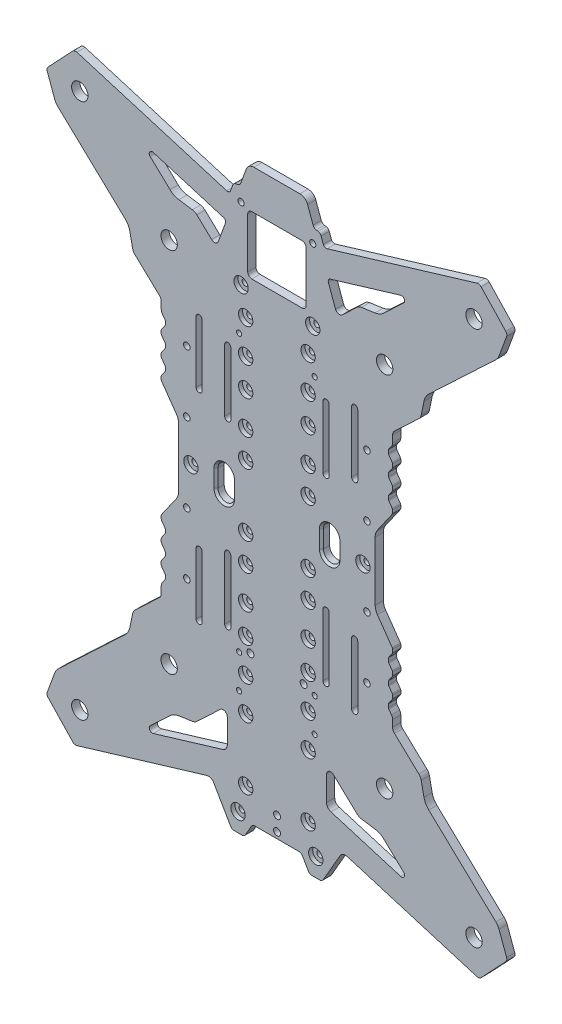
from build123d import *

# Parameters (mm, degrees)
MODEL_R                               = 1.5
MODEL_R_2                             = 4
MAIN_BODY_DEPTH                       = 4
LOWER_START                           = -2
SKETCH2_R                             = 3.5
SKETCH2_R_2                           = 1.5
LOWER_FIXTURE_POINT_COUNTERSINK_DEPTH = 2
EXTRA_BATTERY_STRAP_FIXTURES_REACH    = 419.565
BATTERY_CABLE_INGRESS_REACH           = 419.565
BATTERY_CABLE_INGRESS_CHAMFER_SIZE    = 1
MAUCH_PL200_MOUNTING_POINTS_REACH     = 419.565
SKETCH5_R                             = 1.25
RFD_CARRIER_MOUNTING_POINTS_REACH     = 419.565
SKETCH6_R                             = 1.7
ESC_CARRIER_FIXTURES_POINTS_REACH     = 419.565
SKETCH7_R                             = 1.6


with BuildPart() as part:
    # Model → Main Body (new body)
    with BuildSketch(Plane.XY):
        with BuildLine():
            Line((261.034392191, 314.782999023), (273.061648382, 302.032656534))
            ThreePointArc((273.061648382, 302.032656534), (273.565856978, 301.062828157), (273.484893514, 299.972764714))
            Line((273.484893514, 299.972764714), (269.784614814, 289.86483769))
            ThreePointArc((269.784614814, 289.86483769), (269.160003791, 288.625512695), (268.26736368, 287.562846704))
            Line((268.26736368, 287.562846704), (235.488392783, 256.642773314))
            ThreePointArc((235.488392783, 256.642773314), (233.992515204, 254.722726466), (233.143240584, 252.441726192))
            Line((233.143240584, 252.441726192), (231.792450322, 245.902694328))
            ThreePointArc((231.792450322, 245.902694328), (231.367815262, 244.762192559), (230.619877947, 243.802167042))
            Line((230.619877947, 243.802167042), (218.752224369, 232.607528134))
            ThreePointArc((218.752224369, 232.607528134), (218.056165205, 231.613589887), (217.810761554, 230.425234451))
            Line((217.810761554, 230.425234451), (217.810761554, 227.216127826))
            ThreePointArc((217.810761554, 227.216127826), (217.671912001, 226.314011906), (217.268217725, 225.495401336))
            Line((217.268217725, 225.495401336), (215.991609169, 223.672214462))
            ThreePointArc((215.991609169, 223.672214462), (215.857044411, 223.399344272), (215.810761226, 223.098638965))
            Line((215.810761226, 223.098638965), (215.810761226, 221.729233427))
            ThreePointArc((215.810761226, 221.729233427), (215.857044411, 221.428528121), (215.991609169, 221.155657931))
            Line((215.991609169, 221.155657931), (217.629913611, 218.815918578))
            ThreePointArc((217.629913611, 218.815918578), (217.76447837, 218.543048389), (217.810761554, 218.242343082))
            Line((217.810761554, 218.242343082), (217.810761554, 216.872937544))
            ThreePointArc((217.810761554, 216.872937544), (217.76447837, 216.572232237), (217.629913611, 216.299362047))
            Line((217.629913611, 216.299362047), (215.991609169, 213.959622695))
            ThreePointArc((215.991609169, 213.959622695), (215.857044411, 213.686752505), (215.810761226, 213.386047198))
            Line((215.810761226, 213.386047198), (215.810761226, 212.01664166))
            ThreePointArc((215.810761226, 212.01664166), (215.857044411, 211.715936353), (215.991609169, 211.443066163))
            Line((215.991609169, 211.443066163), (217.629913611, 209.103326811))
            ThreePointArc((217.629913611, 209.103326811), (217.76447837, 208.830456621), (217.810761554, 208.529751314))
            Line((217.810761554, 208.529751314), (217.810761554, 207.160345777))
            ThreePointArc((217.810761554, 207.160345777), (217.76447837, 206.85964047), (217.629913611, 206.58677028))
            Line((217.629913611, 206.58677028), (215.991609169, 204.247030927))
            ThreePointArc((215.991609169, 204.247030927), (215.85704385, 203.974158961), (215.810761226, 203.673451705))
            Line((215.810761226, 203.673451705), (215.810761226, 202.304049893))
            ThreePointArc((215.810761226, 202.304049893), (215.857044411, 202.003344586), (215.991609169, 201.730474396))
            Line((215.991609169, 201.730474396), (217.629913611, 199.390733181))
            ThreePointArc((217.629913611, 199.390733181), (217.76447837, 199.117862991), (217.810761554, 198.817157684))
            Line((217.810761554, 198.817157684), (217.810761554, 197.447755872))
            ThreePointArc((217.810761554, 197.447755872), (217.76447865, 197.147049591), (217.629913611, 196.874178513))
            Line((217.629913611, 196.874178513), (210.395850612, 186.542864455))
            ThreePointArc((210.395850612, 186.542864455), (209.588461221, 184.905640652), (209.310762955, 183.101405887))
            Line((209.310762955, 183.101405887), (209.310762955, 154.232495962))
            ThreePointArc((209.310762955, 154.232495962), (209.588461221, 152.428261198), (210.395850612, 150.791037394))
            Line((210.395850612, 150.791037394), (217.629913611, 140.459723337))
            ThreePointArc((217.629913611, 140.459723337), (217.76447865, 140.186852259), (217.810761554, 139.886145978))
            Line((217.810761554, 139.886145978), (217.810761554, 138.516744165))
            ThreePointArc((217.810761554, 138.516744165), (217.76447837, 138.216038858), (217.629913611, 137.943168669))
            Line((217.629913611, 137.943168669), (215.991609169, 135.603427453))
            ThreePointArc((215.991609169, 135.603427453), (215.857044411, 135.330557264), (215.810761226, 135.029851957))
            Line((215.810761226, 135.029851957), (215.810761226, 133.660450144))
            ThreePointArc((215.810761226, 133.660450144), (215.85704385, 133.359742889), (215.991609169, 133.086870922))
            Line((215.991609169, 133.086870922), (217.629913611, 130.74713157))
            ThreePointArc((217.629913611, 130.74713157), (217.76447837, 130.47426138), (217.810761554, 130.173556073))
            Line((217.810761554, 130.173556073), (217.810761554, 128.804150535))
            ThreePointArc((217.810761554, 128.804150535), (217.76447837, 128.503445228), (217.629913611, 128.230575039))
            Line((217.629913611, 128.230575039), (215.991609169, 125.890835686))
            ThreePointArc((215.991609169, 125.890835686), (215.857044411, 125.617965496), (215.810761226, 125.31726019))
            Line((215.810761226, 125.31726019), (215.810761226, 123.947854652))
            ThreePointArc((215.810761226, 123.947854652), (215.857044411, 123.647149345), (215.991609169, 123.374279155))
            Line((215.991609169, 123.374279155), (217.629913611, 121.034539803))
            ThreePointArc((217.629913611, 121.034539803), (217.76447837, 120.761669613), (217.810761554, 120.460964306))
            Line((217.810761554, 120.460964306), (217.810761554, 119.091558768))
            ThreePointArc((217.810761554, 119.091558768), (217.76447837, 118.790853461), (217.629913611, 118.517983271))
            Line((217.629913611, 118.517983271), (215.991609169, 116.178243919))
            ThreePointArc((215.991609169, 116.178243919), (215.857044411, 115.905373729), (215.810761226, 115.604668422))
            Line((215.810761226, 115.604668422), (215.810761226, 114.235262884))
            ThreePointArc((215.810761226, 114.235262884), (215.857044411, 113.934557578), (215.991609169, 113.661687388))
            Line((215.991609169, 113.661687388), (217.268217725, 111.838500513))
            ThreePointArc((217.268217725, 111.838500513), (217.671912001, 111.019889944), (217.810761554, 110.117774023))
            Line((217.810761554, 110.117774023), (217.810761554, 106.908667399))
            ThreePointArc((217.810761554, 106.908667399), (218.056165205, 105.720311962), (218.752224369, 104.726373716))
            Line((218.752224369, 104.726373716), (230.619877947, 93.531734808))
            ThreePointArc((230.619877947, 93.531734808), (231.367815262, 92.571709291), (231.792450322, 91.431207521))
            Line((231.792450322, 91.431207521), (233.143240584, 84.892175658))
            ThreePointArc((233.143240584, 84.892175658), (233.992515204, 82.611175384), (235.488392783, 80.691128536))
            Line((235.488392783, 80.691128536), (268.26736368, 49.771055146))
            ThreePointArc((268.26736368, 49.771055146), (269.160003791, 48.708389155), (269.784614814, 47.46906416))
            Line((269.784614814, 47.46906416), (273.484893514, 37.361137136))
            ThreePointArc((273.484893514, 37.361137136), (273.565856978, 36.271073693), (273.061648382, 35.301245315))
            Line((273.061648382, 35.301245315), (261.034392191, 22.550902827))
            ThreePointArc((261.034392191, 22.550902827), (260.095615458, 21.990999971), (259.002685917, 22.008262141))
            Line((259.002685917, 22.008262141), (195.639953388, 41.094414456))
            ThreePointArc((195.639953388, 41.094414456), (193.669430203, 41.010883841), (192.17661619, 39.721913202))
            Line((192.17661619, 39.721913202), (183.941960705, 25.45907305))
            ThreePointArc((183.941960705, 25.45907305), (183.209910003, 24.727020953), (182.209909333, 24.459071024))
            Line((182.209909333, 24.459071024), (178.411616383, 24.459071024))
            ThreePointArc((178.411616383, 24.459071024), (177.411615713, 24.727020953), (176.67956501, 25.45907305))
            Line((176.67956501, 25.45907305), (173.792813344, 30.459068282))
            ThreePointArc((173.792813344, 30.459068282), (173.060763045, 31.191120147), (172.060762902, 31.459070309))
            Line((172.060762902, 31.459070309), (150.560762172, 31.459070309))
            ThreePointArc((150.560762172, 31.459070309), (149.56076203, 31.191120147), (148.828711731, 30.459068282))
            Line((148.828711731, 30.459068282), (145.941960064, 25.45907305))
            ThreePointArc((145.941960064, 25.45907305), (145.209909362, 24.727020953), (144.209908692, 24.459071024))
            Line((144.209908692, 24.459071024), (140.411615742, 24.459071024))
            ThreePointArc((140.411615742, 24.459071024), (139.411615072, 24.727020953), (138.67956437, 25.45907305))
            Line((138.67956437, 25.45907305), (130.444908885, 39.721913202))
            ThreePointArc((130.444908885, 39.721913202), (128.952094872, 41.010883841), (126.981571687, 41.094414456))
            Line((126.981571687, 41.094414456), (63.618839157, 22.008262141))
            ThreePointArc((63.618839157, 22.008262141), (62.525909617, 21.990999971), (61.587132884, 22.550902827))
            Line((61.587132884, 22.550902827), (49.559876693, 35.301245315))
            ThreePointArc((49.559876693, 35.301245315), (49.055668097, 36.271073693), (49.136631561, 37.361137136))
            Line((49.136631561, 37.361137136), (52.836910261, 47.46906416))
            ThreePointArc((52.836910261, 47.46906416), (53.461521284, 48.708389155), (54.354161394, 49.771055146))
            Line((54.354161394, 49.771055146), (87.133132292, 80.691128536))
            ThreePointArc((87.133132292, 80.691128536), (88.629009871, 82.611175384), (89.478284491, 84.892175658))
            Line((89.478284491, 84.892175658), (90.829074753, 91.431207521))
            ThreePointArc((90.829074753, 91.431207521), (91.253709813, 92.571709291), (92.001647128, 93.531734808))
            Line((92.001647128, 93.531734808), (103.869300706, 104.726373716))
            ThreePointArc((103.869300706, 104.726373716), (104.565359869, 105.720311962), (104.810763521, 106.908667399))
            Line((104.810763521, 106.908667399), (104.810763521, 110.117774023))
            ThreePointArc((104.810763521, 110.117774023), (104.949613074, 111.019889944), (105.353307349, 111.838500513))
            Line((105.353307349, 111.838500513), (106.629915906, 113.661687388))
            ThreePointArc((106.629915906, 113.661687388), (106.764480664, 113.934557578), (106.810763849, 114.235262884))
            Line((106.810763849, 114.235262884), (106.810763849, 115.604668422))
            ThreePointArc((106.810763849, 115.604668422), (106.764480664, 115.905373729), (106.629915906, 116.178243919))
            Line((106.629915906, 116.178243919), (104.991611464, 118.517983271))
            ThreePointArc((104.991611464, 118.517983271), (104.857046705, 118.790853461), (104.810763521, 119.091558768))
            Line((104.810763521, 119.091558768), (104.810763521, 120.460964306))
            ThreePointArc((104.810763521, 120.460964306), (104.857046705, 120.761669613), (104.991611464, 121.034539803))
            Line((104.991611464, 121.034539803), (106.629915906, 123.374279155))
            ThreePointArc((106.629915906, 123.374279155), (106.764480664, 123.647149345), (106.810763849, 123.947854652))
            Line((106.810763849, 123.947854652), (106.810763849, 125.31726019))
            ThreePointArc((106.810763849, 125.31726019), (106.764480664, 125.617965496), (106.629915906, 125.890835686))
            Line((106.629915906, 125.890835686), (104.991611464, 128.230575039))
            ThreePointArc((104.991611464, 128.230575039), (104.857046705, 128.503445229), (104.810763521, 128.804150535))
            Line((104.810763521, 128.804150535), (104.810763521, 130.173556073))
            ThreePointArc((104.810763521, 130.173556073), (104.857046705, 130.47426138), (104.991611464, 130.74713157))
            Line((104.991611464, 130.74713157), (106.629915906, 133.086870922))
            ThreePointArc((106.629915906, 133.086870922), (106.764481224, 133.359742889), (106.810763849, 133.660450144))
            Line((106.810763849, 133.660450144), (106.810763849, 135.029851957))
            ThreePointArc((106.810763849, 135.029851957), (106.764480664, 135.330557264), (106.629915906, 135.603427453))
            Line((106.629915906, 135.603427453), (104.991611464, 137.943168669))
            ThreePointArc((104.991611464, 137.943168669), (104.857046705, 138.216038858), (104.810763521, 138.516744165))
            Line((104.810763521, 138.516744165), (104.810763521, 139.886145978))
            ThreePointArc((104.810763521, 139.886145978), (104.857046425, 140.186852259), (104.991611464, 140.459723337))
            Line((104.991611464, 140.459723337), (112.225674463, 150.791037394))
            ThreePointArc((112.225674463, 150.791037394), (113.033063854, 152.428261198), (113.31076212, 154.232495962))
            Line((113.31076212, 154.232495962), (113.31076212, 183.101405887))
            ThreePointArc((113.31076212, 183.101405887), (113.033063854, 184.905640652), (112.225674463, 186.542864455))
            Line((112.225674463, 186.542864455), (104.991611464, 196.874178513))
            ThreePointArc((104.991611464, 196.874178513), (104.857046425, 197.147049591), (104.810763521, 197.447755872))
            Line((104.810763521, 197.447755872), (104.810763521, 198.817157684))
            ThreePointArc((104.810763521, 198.817157684), (104.857046705, 199.117862991), (104.991611464, 199.390733181))
            Line((104.991611464, 199.390733181), (106.629915906, 201.730474396))
            ThreePointArc((106.629915906, 201.730474396), (106.764480664, 202.003344586), (106.810763849, 202.304049893))
            Line((106.810763849, 202.304049893), (106.810763849, 203.673451705))
            ThreePointArc((106.810763849, 203.673451705), (106.764481224, 203.974158961), (106.629915906, 204.247030927))
            Line((106.629915906, 204.247030927), (104.991611464, 206.58677028))
            ThreePointArc((104.991611464, 206.58677028), (104.857046705, 206.85964047), (104.810763521, 207.160345777))
            Line((104.810763521, 207.160345777), (104.810763521, 208.529751314))
            ThreePointArc((104.810763521, 208.529751314), (104.857046705, 208.830456621), (104.991611464, 209.103326811))
            Line((104.991611464, 209.103326811), (106.629915906, 211.443066163))
            ThreePointArc((106.629915906, 211.443066163), (106.764480664, 211.715936353), (106.810763849, 212.01664166))
            Line((106.810763849, 212.01664166), (106.810763849, 213.386047198))
            ThreePointArc((106.810763849, 213.386047198), (106.764480664, 213.686752505), (106.629915906, 213.959622695))
            Line((106.629915906, 213.959622695), (104.991611464, 216.299362047))
            ThreePointArc((104.991611464, 216.299362047), (104.857046705, 216.572232237), (104.810763521, 216.872937544))
            Line((104.810763521, 216.872937544), (104.810763521, 218.242343082))
            ThreePointArc((104.810763521, 218.242343082), (104.857046705, 218.543048389), (104.991611464, 218.815918578))
            Line((104.991611464, 218.815918578), (106.629915906, 221.155657931))
            ThreePointArc((106.629915906, 221.155657931), (106.764480664, 221.428528121), (106.810763849, 221.729233427))
            Line((106.810763849, 221.729233427), (106.810763849, 223.098638965))
            ThreePointArc((106.810763849, 223.098638965), (106.764480664, 223.399344272), (106.629915906, 223.672214462))
            Line((106.629915906, 223.672214462), (105.353307349, 225.495401336))
            ThreePointArc((105.353307349, 225.495401336), (104.949613074, 226.314011906), (104.810763521, 227.216127826))
            Line((104.810763521, 227.216127826), (104.810763521, 230.425234451))
            ThreePointArc((104.810763521, 230.425234451), (104.565359869, 231.613589887), (103.869300706, 232.607528134))
            Line((103.869300706, 232.607528134), (92.001647128, 243.802167042))
            ThreePointArc((92.001647128, 243.802167042), (91.253709813, 244.762192559), (90.829074753, 245.902694328))
            Line((90.829074753, 245.902694328), (89.478284491, 252.441726192))
            ThreePointArc((89.478284491, 252.441726192), (88.629009871, 254.722726466), (87.133132292, 256.642773314))
            Line((87.133132292, 256.642773314), (54.354161394, 287.562846704))
            ThreePointArc((54.354161394, 287.562846704), (53.461521284, 288.625512695), (52.836910261, 289.86483769))
            Line((52.836910261, 289.86483769), (49.136631561, 299.972764714))
            ThreePointArc((49.136631561, 299.972764714), (49.055668097, 301.062828157), (49.559876693, 302.032656534))
            Line((49.559876693, 302.032656534), (61.587132884, 314.782999023))
            ThreePointArc((61.587132884, 314.782999023), (62.525909617, 315.342901879), (63.618839157, 315.325639708))
            Line((63.618839157, 315.325639708), (136.809913812, 293.278984292))
            ThreePointArc((136.809913812, 293.278984292), (137.914608643, 293.374219842), (138.652082903, 294.202200635))
            Line((138.652082903, 294.202200635), (139.728013796, 297.158307894))
            ThreePointArc((139.728013796, 297.158307894), (140.321825305, 298.006352282), (141.260102762, 298.443875773))
            Line((141.260102762, 298.443875773), (142.112970723, 298.594258292))
            ThreePointArc((142.112970723, 298.594258292), (143.051251128, 299.031788099), (143.645059688, 299.879841073))
            Line((143.645059688, 299.879841073), (146.325001864, 307.242922051))
            ThreePointArc((146.325001864, 307.242922051), (147.789467359, 309.151448821), (150.083773209, 309.874839647))
            Line((150.083773209, 309.874839647), (172.537751866, 309.874839647))
            ThreePointArc((172.537751866, 309.874839647), (174.832057716, 309.151448821), (176.296523211, 307.242922051))
            Line((176.296523211, 307.242922051), (178.976465387, 299.879841073))
            ThreePointArc((178.976465387, 299.879841073), (179.570273946, 299.031788099), (180.508554352, 298.594258292))
            Line((180.508554352, 298.594258292), (181.361422313, 298.443875773))
            ThreePointArc((181.361422313, 298.443875773), (182.29969977, 298.006352282), (182.893511278, 297.158307894))
            Line((182.893511278, 297.158307894), (183.969442172, 294.202200635))
            ThreePointArc((183.969442172, 294.202200635), (184.706916432, 293.374219842), (185.811611263, 293.278984292))
            Line((185.811611263, 293.278984292), (259.002685917, 315.325639708))
            ThreePointArc((259.002685917, 315.325639708), (260.095615458, 315.342901879), (261.034392191, 314.782999023))
        make_face()
        with Locations((178.810762537, 292.022001283)):
            Circle(MODEL_R, mode=Mode.SUBTRACT)
        with Locations((213.945462155, 258.31672503)):
            Circle(MODEL_R_2, mode=Mode.SUBTRACT)
        with Locations((257.591400323, 299.487492346)):
            Circle(MODEL_R_2, mode=Mode.SUBTRACT)
        with Locations((65.030124751, 299.487492346)):
            Circle(MODEL_R_2, mode=Mode.SUBTRACT)
        with Locations((108.67606292, 258.31672503)):
            Circle(MODEL_R_2, mode=Mode.SUBTRACT)
        with Locations((108.67606292, 79.017176819)):
            Circle(MODEL_R_2, mode=Mode.SUBTRACT)
        with Locations((65.030124751, 37.846409503)):
            Circle(MODEL_R_2, mode=Mode.SUBTRACT)
        with Locations((257.591400323, 37.846409503)):
            Circle(MODEL_R_2, mode=Mode.SUBTRACT)
        with Locations((213.945462155, 79.017176819)):
            Circle(MODEL_R_2, mode=Mode.SUBTRACT)
        with Locations((143.810762537, 292.022001283)):
            Circle(MODEL_R, mode=Mode.SUBTRACT)
        with Locations((176.560762537, 227.916950925)):
            Circle(MODEL_R, mode=Mode.SUBTRACT)
        with Locations((146.060762537, 227.916950925)):
            Circle(MODEL_R, mode=Mode.SUBTRACT)
        with Locations((146.060762537, 123.541950925)):
            Circle(MODEL_R, mode=Mode.SUBTRACT)
        with Locations((176.560762537, 123.541950925)):
            Circle(MODEL_R, mode=Mode.SUBTRACT)
        with Locations((146.060762537, 93.041950925)):
            Circle(MODEL_R, mode=Mode.SUBTRACT)
        with Locations((176.560762537, 93.041950925)):
            Circle(MODEL_R, mode=Mode.SUBTRACT)
        with Locations((180.310762537, 33.459065681)):
            Circle(MODEL_R, mode=Mode.SUBTRACT)
        with Locations((142.310762537, 33.459065681)):
            Circle(MODEL_R, mode=Mode.SUBTRACT)
        with Locations((176.560762537, 76.666950925)):
            Circle(MODEL_R, mode=Mode.SUBTRACT)
        with Locations((146.060762537, 76.666950925)):
            Circle(MODEL_R, mode=Mode.SUBTRACT)
        with Locations((146.060762537, 109.416950925)):
            Circle(MODEL_R, mode=Mode.SUBTRACT)
        with Locations((119.310762537, 168.666950925)):
            Circle(MODEL_R, mode=Mode.SUBTRACT)
        with Locations((176.560762537, 139.916950925)):
            Circle(MODEL_R, mode=Mode.SUBTRACT)
        with Locations((146.060762537, 139.916950925)):
            Circle(MODEL_R, mode=Mode.SUBTRACT)
        with Locations((146.060762537, 213.791950925)):
            Circle(MODEL_R, mode=Mode.SUBTRACT)
        with Locations((176.560762537, 213.791950925)):
            Circle(MODEL_R, mode=Mode.SUBTRACT)
        with Locations((176.560762537, 109.416950925)):
            Circle(MODEL_R, mode=Mode.SUBTRACT)
        with Locations((176.560762537, 197.416950925)):
            Circle(MODEL_R, mode=Mode.SUBTRACT)
        with Locations((176.560762537, 244.291950925)):
            Circle(MODEL_R, mode=Mode.SUBTRACT)
        with Locations((203.310762537, 168.666950925)):
            Circle(MODEL_R, mode=Mode.SUBTRACT)
        with Locations((143.810762537, 257.022001283)):
            Circle(MODEL_R, mode=Mode.SUBTRACT)
        with Locations((178.810762537, 257.022001283)):
            Circle(MODEL_R, mode=Mode.SUBTRACT)
        with Locations((146.060762537, 244.291950925)):
            Circle(MODEL_R, mode=Mode.SUBTRACT)
        with Locations((146.060762537, 46.166950925)):
            Circle(MODEL_R, mode=Mode.SUBTRACT)
        with Locations((146.060762537, 197.416950925)):
            Circle(MODEL_R, mode=Mode.SUBTRACT)
        with Locations((176.560762537, 46.166950925)):
            Circle(MODEL_R, mode=Mode.SUBTRACT)
        with Locations((146.060762537, 183.916950925)):
            Circle(MODEL_R, mode=Mode.SUBTRACT)
        with Locations((146.060762537, 153.416950925)):
            Circle(MODEL_R, mode=Mode.SUBTRACT)
        with Locations((176.560762537, 153.416950925)):
            Circle(MODEL_R, mode=Mode.SUBTRACT)
        with Locations((176.560762537, 183.916950925)):
            Circle(MODEL_R, mode=Mode.SUBTRACT)
        with BuildLine():
            Line((183.810763431, 197.416951446), (183.810763431, 227.916951789))
            ThreePointArc((183.810763431, 227.916951789), (185.310762746, 229.416951104), (186.810762061, 227.916951789))
            Line((186.810762061, 227.916951789), (186.810762061, 197.416951446))
            ThreePointArc((186.810762061, 197.416951446), (185.310762746, 195.916952132), (183.810763431, 197.416951446))
        make_face(mode=Mode.SUBTRACT)
        with BuildLine():
            Line((138.810761643, 139.916950403), (138.810761643, 109.416950061))
            ThreePointArc((138.810761643, 109.416950061), (137.310762329, 107.916950746), (135.810763014, 109.416950061))
            Line((135.810763014, 109.416950061), (135.810763014, 139.916950403))
            ThreePointArc((135.810763014, 139.916950403), (137.310762329, 141.416949718), (138.810761643, 139.916950403))
        make_face(mode=Mode.SUBTRACT)
        with BuildLine():
            Line((186.810762061, 139.916950403), (186.810762061, 109.416950061))
            ThreePointArc((186.810762061, 109.416950061), (185.310762746, 107.916950746), (183.810763431, 109.416950061))
            Line((183.810763431, 109.416950061), (183.810763431, 139.916950403))
            ThreePointArc((183.810763431, 139.916950403), (185.310762746, 141.416949718), (186.810762061, 139.916950403))
        make_face(mode=Mode.SUBTRACT)
        with BuildLine():
            Line((135.810763014, 197.416951446), (135.810763014, 227.916951789))
            ThreePointArc((135.810763014, 227.916951789), (137.310762329, 229.416951104), (138.810761643, 227.916951789))
            Line((138.810761643, 227.916951789), (138.810761643, 197.416951446))
            ThreePointArc((138.810761643, 197.416951446), (137.310762329, 195.916952132), (135.810763014, 197.416951446))
        make_face(mode=Mode.SUBTRACT)
        with BuildLine():
            Line((147.06076253, 264.094478949), (147.06076253, 288.594476445))
            ThreePointArc((147.06076253, 288.594476445), (147.646550285, 290.008687927), (149.060762858, 290.594473048))
            Line((149.060762858, 290.594473048), (173.560762217, 290.594473048))
            ThreePointArc((173.560762217, 290.594473048), (174.97497479, 290.008687927), (175.560762545, 288.594476445))
            Line((175.560762545, 288.594476445), (175.560762545, 264.094478949))
            ThreePointArc((175.560762545, 264.094478949), (174.974977424, 262.68026265), (173.560762217, 262.094474896))
            Line((173.560762217, 262.094474896), (149.060762858, 262.094474896))
            ThreePointArc((149.060762858, 262.094474896), (147.646547651, 262.68026265), (147.06076253, 264.094478949))
        make_face(mode=Mode.SUBTRACT)
        with BuildLine():
            Line((133.688403664, 72.367697521), (122.193541748, 61.524711116))
            ThreePointArc((122.193541748, 61.524711116), (121.191534815, 60.834033021), (120.028213037, 60.476630493))
            Line((120.028213037, 60.476630493), (113.421537353, 59.509470625))
            ThreePointArc((113.421537353, 59.509470625), (111.094892422, 58.79465859), (109.09087993, 57.413294478))
            Line((109.09087993, 57.413294478), (99.422797931, 48.293493255))
            ThreePointArc((99.422797931, 48.293493255), (99.153636079, 46.451307287), (100.884698702, 45.766092403))
            Line((100.884698702, 45.766092403), (134.92602147, 56.020035906))
            ThreePointArc((134.92602147, 56.020035906), (136.468642418, 57.103103666), (137.060761822, 58.892547651))
            Line((137.060761822, 58.892547651), (137.060761822, 70.912830098))
            ThreePointArc((137.060761822, 70.912830098), (135.85300129, 72.749229936), (133.688403664, 72.367697521))
        make_face(mode=Mode.SUBTRACT)
        with BuildLine():
            Line((209.199987722, 59.509470625), (202.593312038, 60.476630493))
            ThreePointArc((202.593312038, 60.476630493), (201.42999026, 60.834033021), (200.427983327, 61.524711116))
            Line((200.427983327, 61.524711116), (188.933121411, 72.367697521))
            ThreePointArc((188.933121411, 72.367697521), (186.768523785, 72.749229936), (185.560763253, 70.912830098))
            Line((185.560763253, 70.912830098), (185.560763253, 58.892547651))
            ThreePointArc((185.560763253, 58.892547651), (186.152882656, 57.103103666), (187.695503605, 56.020035906))
            Line((187.695503605, 56.020035906), (221.736826373, 45.766092403))
            ThreePointArc((221.736826373, 45.766092403), (223.467888996, 46.451307287), (223.198727144, 48.293493255))
            Line((223.198727144, 48.293493255), (213.530645145, 57.413294478))
            ThreePointArc((213.530645145, 57.413294478), (211.526632653, 58.79465859), (209.199987722, 59.509470625))
        make_face(mode=Mode.SUBTRACT)
        with BuildLine():
            Line((113.421537353, 277.824431224), (120.028213037, 276.857271357))
            ThreePointArc((120.028213037, 276.857271357), (121.191534815, 276.499868829), (122.193541748, 275.809190734))
            Line((122.193541748, 275.809190734), (129.428796841, 268.98424284))
            ThreePointArc((129.428796841, 268.98424284), (131.262472413, 268.49303928), (132.680541275, 269.755072458))
            Line((132.680541275, 269.755072458), (136.150926722, 279.289878471))
            ThreePointArc((136.150926722, 279.289878471), (136.082401816, 280.474972249), (135.17401777, 281.239158972))
            Line((135.17401777, 281.239158972), (100.884698702, 291.567809446))
            ThreePointArc((100.884698702, 291.567809446), (99.153636079, 290.882594562), (99.422797931, 289.040408595))
            Line((99.422797931, 289.040408595), (109.09087993, 279.920607372))
            ThreePointArc((109.09087993, 279.920607372), (111.094892422, 278.539243259), (113.421537353, 277.824431224))
        make_face(mode=Mode.SUBTRACT)
        with BuildLine():
            Line((193.192728234, 268.98424284), (200.427983327, 275.809190734))
            ThreePointArc((200.427983327, 275.809190734), (201.42999026, 276.499868829), (202.593312038, 276.857271357))
            Line((202.593312038, 276.857271357), (209.199987722, 277.824431224))
            ThreePointArc((209.199987722, 277.824431224), (211.526632653, 278.539243259), (213.530645145, 279.920607372))
            Line((213.530645145, 279.920607372), (223.198727144, 289.040408595))
            ThreePointArc((223.198727144, 289.040408595), (223.467888996, 290.882594562), (221.736826373, 291.567809446))
            Line((221.736826373, 291.567809446), (187.447507305, 281.239158972))
            ThreePointArc((187.447507305, 281.239158972), (186.539123259, 280.474972249), (186.470598353, 279.289878471))
            Line((186.470598353, 279.289878471), (189.9409838, 269.755072458))
            ThreePointArc((189.9409838, 269.755072458), (191.359052662, 268.49303928), (193.192728234, 268.98424284))
        make_face(mode=Mode.SUBTRACT)
    extrude(amount=MAIN_BODY_DEPTH)

    # Sketch2 → Lower Fixture Point Countersink (cut)
    # profile 1 of 30: a face of its own
    with BuildSketch(Plane.XY.offset(4).offset(LOWER_START)):
        with Locations((176.560762537, 46.166950925)):
            Circle(SKETCH2_R)
    # profile 2 of 30: a face of its own
    with BuildSketch(Plane.XY.offset(4).offset(LOWER_START)):
        with Locations((180.310762537, 33.459065681)):
            Circle(SKETCH2_R)
    # profile 3 of 30: a face of its own
    with BuildSketch(Plane.XY.offset(4).offset(LOWER_START)):
        with Locations((142.310762537, 33.459065681)):
            Circle(SKETCH2_R)
    # profile 4 of 30: a face of its own
    with BuildSketch(Plane.XY.offset(4).offset(LOWER_START)):
        with Locations((146.060762537, 46.166950925)):
            Circle(SKETCH2_R)
    # profile 5 of 30: a face of its own
    with BuildSketch(Plane.XY.offset(4).offset(LOWER_START)):
        with Locations((176.560762537, 76.666950925)):
            Circle(SKETCH2_R)
    # profile 6 of 30: a face of its own
    with BuildSketch(Plane.XY.offset(4).offset(LOWER_START)):
        with Locations((146.060762537, 76.666950925)):
            Circle(SKETCH2_R)
    # profile 7 of 30: a face of its own
    with BuildSketch(Plane.XY.offset(4).offset(LOWER_START)):
        with Locations((146.060762537, 93.041950925)):
            Circle(SKETCH2_R)
    # profile 8 of 30: a face of its own
    with BuildSketch(Plane.XY.offset(4).offset(LOWER_START)):
        with Locations((176.560762537, 93.041950925)):
            Circle(SKETCH2_R)
    # profile 9 of 30: a face of its own
    with BuildSketch(Plane.XY.offset(4).offset(LOWER_START)):
        with Locations((176.560762537, 109.416950925)):
            Circle(SKETCH2_R)
    # profile 10 of 30: a face of its own
    with BuildSketch(Plane.XY.offset(4).offset(LOWER_START)):
        with Locations((146.060762537, 109.416950925)):
            Circle(SKETCH2_R)
    # profile 11 of 30: a face of its own
    with BuildSketch(Plane.XY.offset(4).offset(LOWER_START)):
        with Locations((176.560762537, 123.541950925)):
            Circle(SKETCH2_R)
    # profile 12 of 30: a face of its own
    with BuildSketch(Plane.XY.offset(4).offset(LOWER_START)):
        with Locations((146.060762537, 123.541950925)):
            Circle(SKETCH2_R)
    # profile 13 of 30: a face of its own
    with BuildSketch(Plane.XY.offset(4).offset(LOWER_START)):
        with Locations((146.060762537, 139.916950925)):
            Circle(SKETCH2_R)
    # profile 14 of 30: a face of its own
    with BuildSketch(Plane.XY.offset(4).offset(LOWER_START)):
        with Locations((176.560762537, 139.916950925)):
            Circle(SKETCH2_R)
        with Locations((176.560762537, 139.916950925)):
            Circle(SKETCH2_R_2, mode=Mode.SUBTRACT)
    # profile 15 of 30: a face of its own
    with BuildSketch(Plane.XY.offset(4).offset(LOWER_START)):
        with Locations((203.310762537, 168.666950925)):
            Circle(SKETCH2_R)
    # profile 16 of 30: a face of its own
    with BuildSketch(Plane.XY.offset(4).offset(LOWER_START)):
        with Locations((176.560762537, 153.416950925)):
            Circle(SKETCH2_R)
    # profile 17 of 30: a face of its own
    with BuildSketch(Plane.XY.offset(4).offset(LOWER_START)):
        with Locations((146.060762537, 153.416950925)):
            Circle(SKETCH2_R)
    # profile 18 of 30: a face of its own
    with BuildSketch(Plane.XY.offset(4).offset(LOWER_START)):
        with Locations((119.310762537, 168.666950925)):
            Circle(SKETCH2_R)
    # profile 19 of 30: a face of its own
    with BuildSketch(Plane.XY.offset(4).offset(LOWER_START)):
        with Locations((146.060762537, 183.916950925)):
            Circle(SKETCH2_R)
    # profile 20 of 30: a face of its own
    with BuildSketch(Plane.XY.offset(4).offset(LOWER_START)):
        with Locations((176.560762537, 183.916950925)):
            Circle(SKETCH2_R)
    # profile 21 of 30: a face of its own
    with BuildSketch(Plane.XY.offset(4).offset(LOWER_START)):
        with Locations((176.560762537, 197.416950925)):
            Circle(SKETCH2_R)
    # profile 22 of 30: a face of its own
    with BuildSketch(Plane.XY.offset(4).offset(LOWER_START)):
        with Locations((146.060762537, 197.416950925)):
            Circle(SKETCH2_R)
    # profile 23 of 30: a face of its own
    with BuildSketch(Plane.XY.offset(4).offset(LOWER_START)):
        with Locations((176.560762537, 213.791950925)):
            Circle(SKETCH2_R)
    # profile 24 of 30: a face of its own
    with BuildSketch(Plane.XY.offset(4).offset(LOWER_START)):
        with Locations((146.060762537, 213.791950925)):
            Circle(SKETCH2_R)
    # profile 25 of 30: a face of its own
    with BuildSketch(Plane.XY.offset(4).offset(LOWER_START)):
        with Locations((146.060762537, 227.916950925)):
            Circle(SKETCH2_R)
    # profile 26 of 30: a face of its own
    with BuildSketch(Plane.XY.offset(4).offset(LOWER_START)):
        with Locations((176.560762537, 227.916950925)):
            Circle(SKETCH2_R)
    # profile 27 of 30: a face of its own
    with BuildSketch(Plane.XY.offset(4).offset(LOWER_START)):
        with Locations((176.560762537, 244.291950925)):
            Circle(SKETCH2_R)
    # profile 28 of 30: a face of its own
    with BuildSketch(Plane.XY.offset(4).offset(LOWER_START)):
        with Locations((178.810762537, 257.022001283)):
            Circle(SKETCH2_R)
    # profile 29 of 30: a face of its own
    with BuildSketch(Plane.XY.offset(4).offset(LOWER_START)):
        with Locations((146.060762537, 244.291950925)):
            Circle(SKETCH2_R)
    # profile 30 of 30: a face of its own
    with BuildSketch(Plane.XY.offset(4).offset(LOWER_START)):
        with Locations((143.810762537, 257.022001283)):
            Circle(SKETCH2_R)
    extrude(amount=LOWER_FIXTURE_POINT_COUNTERSINK_DEPTH, mode=Mode.SUBTRACT)

    # Sketch3 → Extra Battery Strap Fixtures (cut, up to next)
    with BuildSketch(Plane(origin=(0, 0, 0), x_dir=(-1, 0, 0), z_dir=(0, 0, -1)), mode=Mode.PRIVATE) as extra_battery_strap_fixtures_sk1:
        with BuildLine():
            Line((-124.810763074, 134.666949077), (-124.810763074, 104.666947885))
            ThreePointArc((-124.810763074, 104.666947885), (-123.310761897, 103.166946708), (-121.81076072, 104.666947885))
            Line((-121.81076072, 104.666947885), (-121.81076072, 134.666949077))
            ThreePointArc((-121.81076072, 134.666949077), (-123.310761897, 136.166950254), (-124.810763074, 134.666949077))
        make_face()
    extra_battery_strap_fixtures_tool1 = extrude(extra_battery_strap_fixtures_sk1.sketch, amount=-EXTRA_BATTERY_STRAP_FIXTURES_REACH, mode=Mode.PRIVATE) & part.part
    # Sketch3 → Extra Battery Strap Fixtures (cut, up to next)
    with BuildSketch(Plane(origin=(0, 0, 0), x_dir=(-1, 0, 0), z_dir=(0, 0, -1)), mode=Mode.PRIVATE) as extra_battery_strap_fixtures_sk2:
        with BuildLine():
            Line((-124.810763074, 232.666953965), (-124.810763074, 202.666952773))
            ThreePointArc((-124.810763074, 202.666952773), (-123.310761897, 201.166951595), (-121.81076072, 202.666952773))
            Line((-121.81076072, 202.666952773), (-121.81076072, 232.666953965))
            ThreePointArc((-121.81076072, 232.666953965), (-123.310761897, 234.166955142), (-124.810763074, 232.666953965))
        make_face()
    extra_battery_strap_fixtures_tool2 = extrude(extra_battery_strap_fixtures_sk2.sketch, amount=-EXTRA_BATTERY_STRAP_FIXTURES_REACH, mode=Mode.PRIVATE) & part.part
    # Sketch3 → Extra Battery Strap Fixtures (cut, up to next)
    with BuildSketch(Plane(origin=(0, 0, 0), x_dir=(-1, 0, 0), z_dir=(0, 0, -1)), mode=Mode.PRIVATE) as extra_battery_strap_fixtures_sk3:
        with BuildLine():
            Line((-200.810764355, 232.666953965), (-200.810764355, 202.666952773))
            ThreePointArc((-200.810764355, 202.666952773), (-199.310763178, 201.166951595), (-197.810762001, 202.666952773))
            Line((-197.810762001, 202.666952773), (-197.810762001, 232.666953965))
            ThreePointArc((-197.810762001, 232.666953965), (-199.310763178, 234.166955142), (-200.810764355, 232.666953965))
        make_face()
    extra_battery_strap_fixtures_tool3 = extrude(extra_battery_strap_fixtures_sk3.sketch, amount=-EXTRA_BATTERY_STRAP_FIXTURES_REACH, mode=Mode.PRIVATE) & part.part
    # Sketch3 → Extra Battery Strap Fixtures (cut, up to next)
    with BuildSketch(Plane(origin=(0, 0, 0), x_dir=(-1, 0, 0), z_dir=(0, 0, -1)), mode=Mode.PRIVATE) as extra_battery_strap_fixtures_sk4:
        with BuildLine():
            Line((-197.810762001, 104.666947885), (-197.810762001, 134.666949077))
            ThreePointArc((-197.810762001, 134.666949077), (-199.310763178, 136.166950254), (-200.810764355, 134.666949077))
            Line((-200.810764355, 134.666949077), (-200.810764355, 104.666947885))
            ThreePointArc((-200.810764355, 104.666947885), (-199.310763178, 103.166946708), (-197.810762001, 104.666947885))
        make_face()
    extra_battery_strap_fixtures_tool4 = extrude(extra_battery_strap_fixtures_sk4.sketch, amount=-EXTRA_BATTERY_STRAP_FIXTURES_REACH, mode=Mode.PRIVATE) & part.part
    add(extra_battery_strap_fixtures_tool1.solids().sort_by_distance((123.310762, 119.666948, 0))[0], mode=Mode.SUBTRACT)
    add(extra_battery_strap_fixtures_tool2.solids().sort_by_distance((123.310762, 217.666953, 0))[0], mode=Mode.SUBTRACT)
    add(extra_battery_strap_fixtures_tool3.solids().sort_by_distance((199.310763, 217.666953, 0))[0], mode=Mode.SUBTRACT)
    add(extra_battery_strap_fixtures_tool4.solids().sort_by_distance((199.310763, 119.666948, 0))[0], mode=Mode.SUBTRACT)

    # Sketch4 → Battery Cable Ingress (cut, up to next)
    with BuildSketch(Plane(origin=(0, 0, 0), x_dir=(-1, 0, 0), z_dir=(0, 0, -1)), mode=Mode.PRIVATE) as battery_cable_ingress_sk1:
        with BuildLine():
            Line((-191.060763257, 164.416950065), (-191.060763257, 172.916950065))
            ThreePointArc((-191.060763257, 172.916950065), (-187.060763257, 176.916950065), (-183.060763257, 172.916950065))
            Line((-183.060763257, 172.916950065), (-183.060763257, 164.416950065))
            ThreePointArc((-183.060763257, 164.416950065), (-187.060763257, 160.416950065), (-191.060763257, 164.416950065))
        make_face()
    battery_cable_ingress_tool1 = extrude(battery_cable_ingress_sk1.sketch, amount=-BATTERY_CABLE_INGRESS_REACH, mode=Mode.PRIVATE) & part.part
    # Sketch4 → Battery Cable Ingress (cut, up to next)
    with BuildSketch(Plane(origin=(0, 0, 0), x_dir=(-1, 0, 0), z_dir=(0, 0, -1)), mode=Mode.PRIVATE) as battery_cable_ingress_sk2:
        with BuildLine():
            Line((-131.560763257, 172.916950065), (-131.560763257, 164.416950065))
            ThreePointArc((-131.560763257, 164.416950065), (-135.560763257, 160.416950065), (-139.560763257, 164.416950065))
            Line((-139.560763257, 164.416950065), (-139.560763257, 172.916950065))
            ThreePointArc((-139.560763257, 172.916950065), (-135.560763257, 176.916950065), (-131.560763257, 172.916950065))
        make_face()
    battery_cable_ingress_tool2 = extrude(battery_cable_ingress_sk2.sketch, amount=-BATTERY_CABLE_INGRESS_REACH, mode=Mode.PRIVATE) & part.part
    add(battery_cable_ingress_tool1.solids().sort_by_distance((187.060763, 168.66695, 0))[0], mode=Mode.SUBTRACT)
    add(battery_cable_ingress_tool2.solids().sort_by_distance((135.560763, 168.66695, 0))[0], mode=Mode.SUBTRACT)

    # Battery Cable Ingress Chamfer
    battery_cable_ingress_chamfer_edges = [part.edges().sort_by_distance(p)[0] for p in [
        (131.560763257, 168.666950065, 4),
        (139.560763257, 168.666950065, 4),
        (183.060763257, 168.666950065, 4),
        (191.060763257, 168.666950065, 4),
    ]]
    chamfer(battery_cable_ingress_chamfer_edges, length=BATTERY_CABLE_INGRESS_CHAMFER_SIZE)

    # Sketch5 → Mauch PL200 Mounting Points (cut, up to next)
    with BuildSketch(Plane(origin=(0, 0, 0), x_dir=(-1, 0, 0), z_dir=(0, 0, -1)), mode=Mode.PRIVATE) as mauch_pl200_mounting_points_sk1:
        with Locations((-142.860762537, 84.854450925)):
            Circle(SKETCH5_R)
    mauch_pl200_mounting_points_tool1 = extrude(mauch_pl200_mounting_points_sk1.sketch, amount=-MAUCH_PL200_MOUNTING_POINTS_REACH, mode=Mode.PRIVATE) & part.part
    # Sketch5 → Mauch PL200 Mounting Points (cut, up to next)
    with BuildSketch(Plane(origin=(0, 0, 0), x_dir=(-1, 0, 0), z_dir=(0, 0, -1)), mode=Mode.PRIVATE) as mauch_pl200_mounting_points_sk2:
        with Locations((-142.860762537, 101.229450925)):
            Circle(SKETCH5_R)
    mauch_pl200_mounting_points_tool2 = extrude(mauch_pl200_mounting_points_sk2.sketch, amount=-MAUCH_PL200_MOUNTING_POINTS_REACH, mode=Mode.PRIVATE) & part.part
    # Sketch5 → Mauch PL200 Mounting Points (cut, up to next)
    with BuildSketch(Plane(origin=(0, 0, 0), x_dir=(-1, 0, 0), z_dir=(0, 0, -1)), mode=Mode.PRIVATE) as mauch_pl200_mounting_points_sk3:
        with Locations((-142.860762537, 236.104450925)):
            Circle(SKETCH5_R)
    mauch_pl200_mounting_points_tool3 = extrude(mauch_pl200_mounting_points_sk3.sketch, amount=-MAUCH_PL200_MOUNTING_POINTS_REACH, mode=Mode.PRIVATE) & part.part
    # Sketch5 → Mauch PL200 Mounting Points (cut, up to next)
    with BuildSketch(Plane(origin=(0, 0, 0), x_dir=(-1, 0, 0), z_dir=(0, 0, -1)), mode=Mode.PRIVATE) as mauch_pl200_mounting_points_sk4:
        with Locations((-179.760762537, 236.104450925)):
            Circle(SKETCH5_R)
    mauch_pl200_mounting_points_tool4 = extrude(mauch_pl200_mounting_points_sk4.sketch, amount=-MAUCH_PL200_MOUNTING_POINTS_REACH, mode=Mode.PRIVATE) & part.part
    # Sketch5 → Mauch PL200 Mounting Points (cut, up to next)
    with BuildSketch(Plane(origin=(0, 0, 0), x_dir=(-1, 0, 0), z_dir=(0, 0, -1)), mode=Mode.PRIVATE) as mauch_pl200_mounting_points_sk5:
        with Locations((-179.760762537, 101.229450925)):
            Circle(SKETCH5_R)
    mauch_pl200_mounting_points_tool5 = extrude(mauch_pl200_mounting_points_sk5.sketch, amount=-MAUCH_PL200_MOUNTING_POINTS_REACH, mode=Mode.PRIVATE) & part.part
    # Sketch5 → Mauch PL200 Mounting Points (cut, up to next)
    with BuildSketch(Plane(origin=(0, 0, 0), x_dir=(-1, 0, 0), z_dir=(0, 0, -1)), mode=Mode.PRIVATE) as mauch_pl200_mounting_points_sk6:
        with Locations((-179.760762537, 84.854450925)):
            Circle(SKETCH5_R)
    mauch_pl200_mounting_points_tool6 = extrude(mauch_pl200_mounting_points_sk6.sketch, amount=-MAUCH_PL200_MOUNTING_POINTS_REACH, mode=Mode.PRIVATE) & part.part
    add(mauch_pl200_mounting_points_tool1.solids().sort_by_distance((142.860763, 84.854451, 0))[0], mode=Mode.SUBTRACT)
    add(mauch_pl200_mounting_points_tool2.solids().sort_by_distance((142.860763, 101.229451, 0))[0], mode=Mode.SUBTRACT)
    add(mauch_pl200_mounting_points_tool3.solids().sort_by_distance((142.860763, 236.104451, 0))[0], mode=Mode.SUBTRACT)
    add(mauch_pl200_mounting_points_tool4.solids().sort_by_distance((179.760763, 236.104451, 0))[0], mode=Mode.SUBTRACT)
    add(mauch_pl200_mounting_points_tool5.solids().sort_by_distance((179.760763, 101.229451, 0))[0], mode=Mode.SUBTRACT)
    add(mauch_pl200_mounting_points_tool6.solids().sort_by_distance((179.760763, 84.854451, 0))[0], mode=Mode.SUBTRACT)

    # Sketch6 → RFD Carrier Mounting Points (cut, up to next)
    with BuildSketch(Plane(origin=(0, 0, 0), x_dir=(-1, 0, 0), z_dir=(0, 0, -1)), mode=Mode.PRIVATE) as rfd_carrier_mounting_points_sk1:
        with Locations((-174.3687786, 103.411268058)):
            Circle(SKETCH6_R)
    rfd_carrier_mounting_points_tool1 = extrude(rfd_carrier_mounting_points_sk1.sketch, amount=-RFD_CARRIER_MOUNTING_POINTS_REACH, mode=Mode.PRIVATE) & part.part
    # Sketch6 → RFD Carrier Mounting Points (cut, up to next)
    with BuildSketch(Plane(origin=(0, 0, 0), x_dir=(-1, 0, 0), z_dir=(0, 0, -1)), mode=Mode.PRIVATE) as rfd_carrier_mounting_points_sk2:
        with Locations((-148.3687786, 103.411268058)):
            Circle(SKETCH6_R)
    rfd_carrier_mounting_points_tool2 = extrude(rfd_carrier_mounting_points_sk2.sketch, amount=-RFD_CARRIER_MOUNTING_POINTS_REACH, mode=Mode.PRIVATE) & part.part
    # Sketch6 → RFD Carrier Mounting Points (cut, up to next)
    with BuildSketch(Plane(origin=(0, 0, 0), x_dir=(-1, 0, 0), z_dir=(0, 0, -1)), mode=Mode.PRIVATE) as rfd_carrier_mounting_points_sk3:
        with Locations((-161.3687786, 34.411268058)):
            Circle(SKETCH6_R)
    rfd_carrier_mounting_points_tool3 = extrude(rfd_carrier_mounting_points_sk3.sketch, amount=-RFD_CARRIER_MOUNTING_POINTS_REACH, mode=Mode.PRIVATE) & part.part
    # Sketch6 → RFD Carrier Mounting Points (cut, up to next)
    with BuildSketch(Plane(origin=(0, 0, 0), x_dir=(-1, 0, 0), z_dir=(0, 0, -1)), mode=Mode.PRIVATE) as rfd_carrier_mounting_points_sk4:
        with Locations((-161.3687786, 41.411268058)):
            Circle(SKETCH6_R)
    rfd_carrier_mounting_points_tool4 = extrude(rfd_carrier_mounting_points_sk4.sketch, amount=-RFD_CARRIER_MOUNTING_POINTS_REACH, mode=Mode.PRIVATE) & part.part
    add(rfd_carrier_mounting_points_tool1.solids().sort_by_distance((174.368779, 103.411268, 0))[0], mode=Mode.SUBTRACT)
    add(rfd_carrier_mounting_points_tool2.solids().sort_by_distance((148.368779, 103.411268, 0))[0], mode=Mode.SUBTRACT)
    add(rfd_carrier_mounting_points_tool3.solids().sort_by_distance((161.368779, 34.411268, 0))[0], mode=Mode.SUBTRACT)
    add(rfd_carrier_mounting_points_tool4.solids().sort_by_distance((161.368779, 41.411268, 0))[0], mode=Mode.SUBTRACT)

    # Sketch7 → ESC Carrier Fixtures Points (cut, up to next)
    with BuildSketch(Plane(origin=(0, 0, 0), x_dir=(-1, 0, 0), z_dir=(0, 0, -1)), mode=Mode.PRIVATE) as esc_carrier_fixtures_points_sk1:
        with Locations((-205.310762567, 217.889487803)):
            Circle(SKETCH7_R)
    esc_carrier_fixtures_points_tool1 = extrude(esc_carrier_fixtures_points_sk1.sketch, amount=-ESC_CARRIER_FIXTURES_POINTS_REACH, mode=Mode.PRIVATE) & part.part
    # Sketch7 → ESC Carrier Fixtures Points (cut, up to next)
    with BuildSketch(Plane(origin=(0, 0, 0), x_dir=(-1, 0, 0), z_dir=(0, 0, -1)), mode=Mode.PRIVATE) as esc_carrier_fixtures_points_sk2:
        with Locations((-205.310762567, 187.889487803)):
            Circle(SKETCH7_R)
    esc_carrier_fixtures_points_tool2 = extrude(esc_carrier_fixtures_points_sk2.sketch, amount=-ESC_CARRIER_FIXTURES_POINTS_REACH, mode=Mode.PRIVATE) & part.part
    # Sketch7 → ESC Carrier Fixtures Points (cut, up to next)
    with BuildSketch(Plane(origin=(0, 0, 0), x_dir=(-1, 0, 0), z_dir=(0, 0, -1)), mode=Mode.PRIVATE) as esc_carrier_fixtures_points_sk3:
        with Locations((-205.310762567, 149.389487803)):
            Circle(SKETCH7_R)
    esc_carrier_fixtures_points_tool3 = extrude(esc_carrier_fixtures_points_sk3.sketch, amount=-ESC_CARRIER_FIXTURES_POINTS_REACH, mode=Mode.PRIVATE) & part.part
    # Sketch7 → ESC Carrier Fixtures Points (cut, up to next)
    with BuildSketch(Plane(origin=(0, 0, 0), x_dir=(-1, 0, 0), z_dir=(0, 0, -1)), mode=Mode.PRIVATE) as esc_carrier_fixtures_points_sk4:
        with Locations((-205.310762567, 119.389487803)):
            Circle(SKETCH7_R)
    esc_carrier_fixtures_points_tool4 = extrude(esc_carrier_fixtures_points_sk4.sketch, amount=-ESC_CARRIER_FIXTURES_POINTS_REACH, mode=Mode.PRIVATE) & part.part
    # Sketch7 → ESC Carrier Fixtures Points (cut, up to next)
    with BuildSketch(Plane(origin=(0, 0, 0), x_dir=(-1, 0, 0), z_dir=(0, 0, -1)), mode=Mode.PRIVATE) as esc_carrier_fixtures_points_sk5:
        with Locations((-117.310762508, 119.389487803)):
            Circle(SKETCH7_R)
    esc_carrier_fixtures_points_tool5 = extrude(esc_carrier_fixtures_points_sk5.sketch, amount=-ESC_CARRIER_FIXTURES_POINTS_REACH, mode=Mode.PRIVATE) & part.part
    # Sketch7 → ESC Carrier Fixtures Points (cut, up to next)
    with BuildSketch(Plane(origin=(0, 0, 0), x_dir=(-1, 0, 0), z_dir=(0, 0, -1)), mode=Mode.PRIVATE) as esc_carrier_fixtures_points_sk6:
        with Locations((-117.310762508, 149.389487803)):
            Circle(SKETCH7_R)
    esc_carrier_fixtures_points_tool6 = extrude(esc_carrier_fixtures_points_sk6.sketch, amount=-ESC_CARRIER_FIXTURES_POINTS_REACH, mode=Mode.PRIVATE) & part.part
    # Sketch7 → ESC Carrier Fixtures Points (cut, up to next)
    with BuildSketch(Plane(origin=(0, 0, 0), x_dir=(-1, 0, 0), z_dir=(0, 0, -1)), mode=Mode.PRIVATE) as esc_carrier_fixtures_points_sk7:
        with Locations((-117.310762508, 187.889487803)):
            Circle(SKETCH7_R)
    esc_carrier_fixtures_points_tool7 = extrude(esc_carrier_fixtures_points_sk7.sketch, amount=-ESC_CARRIER_FIXTURES_POINTS_REACH, mode=Mode.PRIVATE) & part.part
    # Sketch7 → ESC Carrier Fixtures Points (cut, up to next)
    with BuildSketch(Plane(origin=(0, 0, 0), x_dir=(-1, 0, 0), z_dir=(0, 0, -1)), mode=Mode.PRIVATE) as esc_carrier_fixtures_points_sk8:
        with Locations((-117.310762508, 217.889487803)):
            Circle(SKETCH7_R)
    esc_carrier_fixtures_points_tool8 = extrude(esc_carrier_fixtures_points_sk8.sketch, amount=-ESC_CARRIER_FIXTURES_POINTS_REACH, mode=Mode.PRIVATE) & part.part
    add(esc_carrier_fixtures_points_tool1.solids().sort_by_distance((205.310763, 217.889488, 0))[0], mode=Mode.SUBTRACT)
    add(esc_carrier_fixtures_points_tool2.solids().sort_by_distance((205.310763, 187.889488, 0))[0], mode=Mode.SUBTRACT)
    add(esc_carrier_fixtures_points_tool3.solids().sort_by_distance((205.310763, 149.389488, 0))[0], mode=Mode.SUBTRACT)
    add(esc_carrier_fixtures_points_tool4.solids().sort_by_distance((205.310763, 119.389488, 0))[0], mode=Mode.SUBTRACT)
    add(esc_carrier_fixtures_points_tool5.solids().sort_by_distance((117.310763, 119.389488, 0))[0], mode=Mode.SUBTRACT)
    add(esc_carrier_fixtures_points_tool6.solids().sort_by_distance((117.310763, 149.389488, 0))[0], mode=Mode.SUBTRACT)
    add(esc_carrier_fixtures_points_tool7.solids().sort_by_distance((117.310763, 187.889488, 0))[0], mode=Mode.SUBTRACT)
    add(esc_carrier_fixtures_points_tool8.solids().sort_by_distance((117.310763, 217.889488, 0))[0], mode=Mode.SUBTRACT)


solid = part.part
